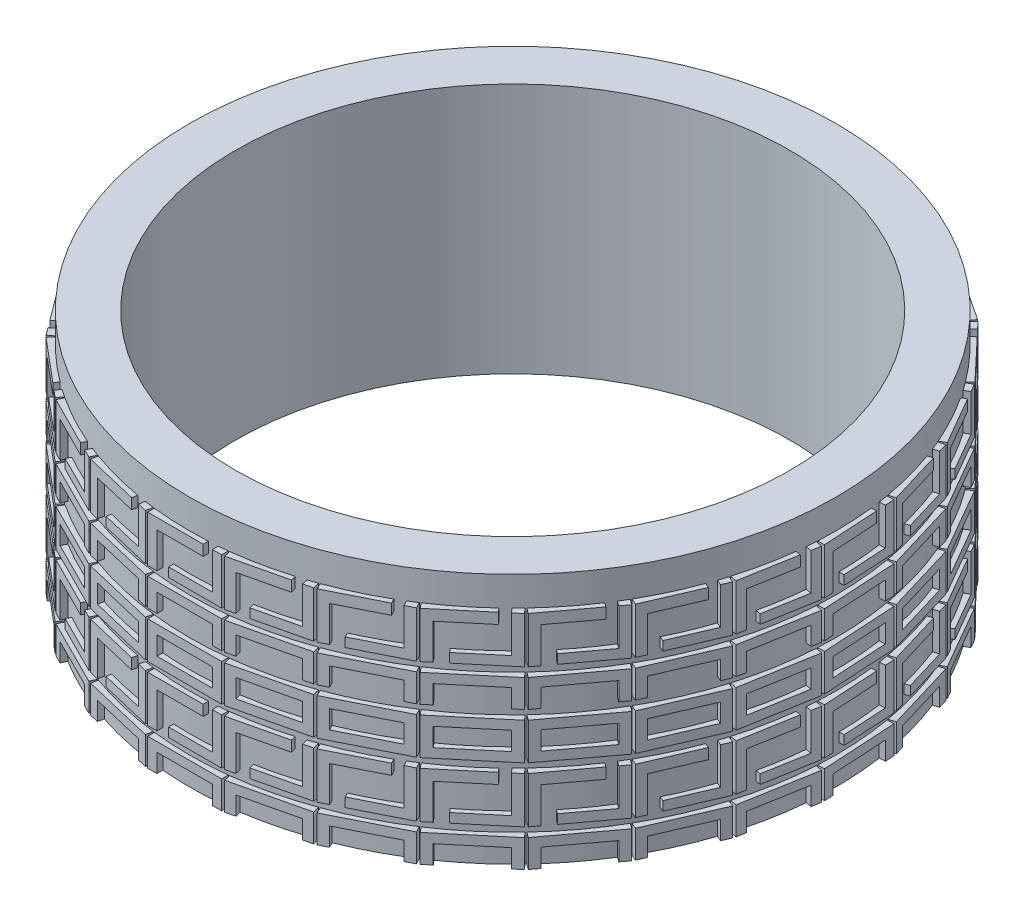
from build123d import *

# Parameters (mm, degrees)
CROQUIS1_R              = 35
CROQUIS1_R_2            = 30
SALIENTE_EXTRUIR1_DEPTH = 27.164179104
SALIENTE_EXTRUIR2_DEPTH = 0.5
MATRIZL1_COUNT          = 2
MATRIZL1_PITCH          = 15
CROQUIS3_W              = 8
CROQUIS3_H              = 4
CROQUIS3_W_2            = 6
CROQUIS3_H_2            = 2
SALIENTE_EXTRUIR3_DEPTH = 0.5
MATRIZC1_COUNT          = 27
MATRIZC1_COPY_1_DEPTH   = 0.5
MATRIZC1_COPY_2_DEPTH   = 0.5
MATRIZC1_COPY_3_DEPTH   = 0.5
MATRIZC1_COPY_4_DEPTH   = 0.5
MATRIZC1_COPY_5_DEPTH   = 0.5
MATRIZC1_COPY_6_DEPTH   = 0.5
MATRIZC1_COPY_7_DEPTH   = 0.5
MATRIZC1_COPY_8_DEPTH   = 0.5
MATRIZC1_COPY_9_DEPTH   = 0.5
MATRIZC1_COPY_10_DEPTH  = 0.5
MATRIZC1_COPY_11_DEPTH  = 0.5
MATRIZC1_COPY_12_DEPTH  = 0.5
MATRIZC1_COPY_13_DEPTH  = 0.5
MATRIZC1_COPY_14_DEPTH  = 0.5
MATRIZC1_COPY_15_DEPTH  = 0.5
MATRIZC1_COPY_16_DEPTH  = 0.5
MATRIZC1_COPY_17_DEPTH  = 0.5
MATRIZC1_COPY_18_DEPTH  = 0.5
MATRIZC1_COPY_19_DEPTH  = 0.5
MATRIZC1_COPY_20_DEPTH  = 0.5
MATRIZC1_COPY_21_DEPTH  = 0.5
MATRIZC1_COPY_22_DEPTH  = 0.5
MATRIZC1_COPY_23_DEPTH  = 0.5
MATRIZC1_COPY_24_DEPTH  = 0.5
MATRIZC1_COPY_25_DEPTH  = 0.5
MATRIZC1_COPY_26_DEPTH  = 0.5
SCALE1_SCALE            = 0.957142857


with BuildPart() as part:
    # Croquis1 → Saliente-Extruir1 (new body)
    with BuildSketch(Plane(origin=(0, 0, 0), x_dir=(1, 0, 0), z_dir=(0, 1, 0))):
        Circle(CROQUIS1_R)
        Circle(CROQUIS1_R_2, mode=Mode.SUBTRACT)
    extrude(amount=SALIENTE_EXTRUIR1_DEPTH)

    # Croquis2 → Saliente-Extruir2 (add, symmetric)
    with BuildSketch(Plane.XY.offset(35)):
        Polygon((-4, 0), (-4, 3), (4, 3), (4, 0), (3, 0), (3, 2), (-3, 2), (-3, 0), align=None)
        Polygon((0.140203198, 4), (4, 4), (4, 9), (3, 9), (3, 5), (-1.743288023, 5), (-1.743288023, 4), align=None)
        Polygon((-3, 4), (-3, 7.851159128), (2, 7.851159128), (2, 9), (-4, 9), (-4, 4), align=None)
    saliente_extruir2 = extrude(amount=SALIENTE_EXTRUIR2_DEPTH, both=True)

    # MatrizL1: Saliente-Extruir2 ×2
    with Locations(*[(0, i * MATRIZL1_PITCH, 0) for i in range(1, MATRIZL1_COUNT)]):
        add(saliente_extruir2)

    # Croquis3 → Saliente-Extruir3 (add, symmetric)
    with BuildSketch(Plane.XY.offset(35)):
        with Locations((0, 12)):
            Rectangle(CROQUIS3_W, CROQUIS3_H)
        with Locations((0, 12)):
            Rectangle(CROQUIS3_W_2, CROQUIS3_H_2, mode=Mode.SUBTRACT)
    saliente_extruir3 = extrude(amount=SALIENTE_EXTRUIR3_DEPTH, both=True)

    # MatrizC1: Saliente-Extruir2, Saliente-Extruir3 ×27 about axis
    matrizc1_axis = Axis((0, 0, 0), (0, 1, 0))
    add([saliente_extruir2.rotate(matrizc1_axis, i * 360 / MATRIZC1_COUNT) for i in range(1, MATRIZC1_COUNT)])
    add([saliente_extruir3.rotate(matrizc1_axis, i * 360 / MATRIZC1_COUNT) for i in range(1, MATRIZC1_COUNT)])

    # MatrizC1 copy 1 sketch → MatrizC1 copy 1 (add, symmetric)
    with BuildSketch(Plane(origin=(8.071555476, 15, 34.05657047), x_dir=(0.9730448705798238, 0, -0.23061587074244017), z_dir=(0.23061587074244017, 0, 0.9730448705798238))):
        Polygon((-4, 0), (-4, 3), (4, 3), (4, 0), (3, 0), (3, 2), (-3, 2), (-3, 0), align=None)
        Polygon((0.140203198, 4), (4, 4), (4, 9), (3, 9), (3, 5), (-1.743288023, 5), (-1.743288023, 4), align=None)
        Polygon((-3, 4), (-3, 7.851159128), (2, 7.851159128), (2, 9), (-4, 9), (-4, 4), align=None)
    extrude(amount=MATRIZC1_COPY_1_DEPTH, both=True)

    # MatrizC1 copy 2 sketch → MatrizC1 copy 2 (add, symmetric)
    with BuildSketch(Plane(origin=(15.707971307, 15, 31.277142411), x_dir=(0.8936326403234123, 0, -0.44879918020046217), z_dir=(0.44879918020046217, 0, 0.8936326403234123))):
        Polygon((-4, 0), (-4, 3), (4, 3), (4, 0), (3, 0), (3, 2), (-3, 2), (-3, 0), align=None)
        Polygon((0.140203198, 4), (4, 4), (4, 9), (3, 9), (3, 5), (-1.743288023, 5), (-1.743288023, 4), align=None)
        Polygon((-3, 4), (-3, 7.851159128), (2, 7.851159128), (2, 9), (-4, 9), (-4, 4), align=None)
    extrude(amount=MATRIZC1_COPY_2_DEPTH, both=True)

    # MatrizC1 copy 3 sketch → MatrizC1 copy 3 (add, symmetric)
    with BuildSketch(Plane(origin=(22.497566339, 15, 26.811555509), x_dir=(0.766044443118978, 0, -0.6427876096865393), z_dir=(0.6427876096865393, 0, 0.766044443118978))):
        Polygon((-4, 0), (-4, 3), (4, 3), (4, 0), (3, 0), (3, 2), (-3, 2), (-3, 0), align=None)
        Polygon((0.140203198, 4), (4, 4), (4, 9), (3, 9), (3, 5), (-1.743288023, 5), (-1.743288023, 4), align=None)
        Polygon((-3, 4), (-3, 7.851159128), (2, 7.851159128), (2, 9), (-4, 9), (-4, 4), align=None)
    extrude(amount=MATRIZC1_COPY_3_DEPTH, both=True)

    # MatrizC1 copy 4 sketch → MatrizC1 copy 4 (add, symmetric)
    with BuildSketch(Plane(origin=(28.074311746, 15, 20.90055071), x_dir=(0.5971585917027862, 0, -0.8021231927550437), z_dir=(0.8021231927550437, 0, 0.5971585917027862))):
        Polygon((-4, 0), (-4, 3), (4, 3), (4, 0), (3, 0), (3, 2), (-3, 2), (-3, 0), align=None)
        Polygon((0.140203198, 4), (4, 4), (4, 9), (3, 9), (3, 5), (-1.743288023, 5), (-1.743288023, 4), align=None)
        Polygon((-3, 4), (-3, 7.851159128), (2, 7.851159128), (2, 9), (-4, 9), (-4, 4), align=None)
    extrude(amount=MATRIZC1_COPY_4_DEPTH, both=True)

    # MatrizC1 copy 5 sketch → MatrizC1 copy 5 (add, symmetric)
    with BuildSketch(Plane(origin=(32.137563741, 15, 13.862791811), x_dir=(0.39607976603915673, 0, -0.9182161068802741), z_dir=(0.9182161068802741, 0, 0.39607976603915673))):
        Polygon((-4, 0), (-4, 3), (4, 3), (4, 0), (3, 0), (3, 2), (-3, 2), (-3, 0), align=None)
        Polygon((0.140203198, 4), (4, 4), (4, 9), (3, 9), (3, 5), (-1.743288023, 5), (-1.743288023, 4), align=None)
        Polygon((-3, 4), (-3, 7.851159128), (2, 7.851159128), (2, 9), (-4, 9), (-4, 4), align=None)
    extrude(amount=MATRIZC1_COPY_5_DEPTH, both=True)

    # MatrizC1 copy 6 sketch → MatrizC1 copy 6 (add, symmetric)
    with BuildSketch(Plane(origin=(34.468271355, 15, 6.077686218), x_dir=(0.17364817766693041, 0, -0.984807753012208), z_dir=(0.984807753012208, 0, 0.17364817766693041))):
        Polygon((-4, 0), (-4, 3), (4, 3), (4, 0), (3, 0), (3, 2), (-3, 2), (-3, 0), align=None)
        Polygon((0.140203198, 4), (4, 4), (4, 9), (3, 9), (3, 5), (-1.743288023, 5), (-1.743288023, 4), align=None)
        Polygon((-3, 4), (-3, 7.851159128), (2, 7.851159128), (2, 9), (-4, 9), (-4, 4), align=None)
    extrude(amount=MATRIZC1_COPY_6_DEPTH, both=True)

    # MatrizC1 copy 7 sketch → MatrizC1 copy 7 (add, symmetric)
    with BuildSketch(Plane(origin=(34.940785539, 15, -2.035069012), x_dir=(-0.058144828910475996, 0, -0.9983081582712682), z_dir=(0.9983081582712682, 0, -0.058144828910475996))):
        Polygon((-4, 0), (-4, 3), (4, 3), (4, 0), (3, 0), (3, 2), (-3, 2), (-3, 0), align=None)
        Polygon((0.140203198, 4), (4, 4), (4, 9), (3, 9), (3, 5), (-1.743288023, 5), (-1.743288023, 4), align=None)
        Polygon((-3, 4), (-3, 7.851159128), (2, 7.851159128), (2, 9), (-4, 9), (-4, 4), align=None)
    extrude(amount=MATRIZC1_COPY_7_DEPTH, both=True)

    # MatrizC1 copy 8 sketch → MatrizC1 copy 8 (add, symmetric)
    with BuildSketch(Plane(origin=(33.529632931, 15, -10.038113145), x_dir=(-0.2868032327110902, 0, -0.9579895123154889), z_dir=(0.9579895123154889, 0, -0.2868032327110902))):
        Polygon((-4, 0), (-4, 3), (4, 3), (4, 0), (3, 0), (3, 2), (-3, 2), (-3, 0), align=None)
        Polygon((0.140203198, 4), (4, 4), (4, 9), (3, 9), (3, 5), (-1.743288023, 5), (-1.743288023, 4), align=None)
        Polygon((-3, 4), (-3, 7.851159128), (2, 7.851159128), (2, 9), (-4, 9), (-4, 4), align=None)
    extrude(amount=MATRIZC1_COPY_8_DEPTH, both=True)

    # MatrizC1 copy 9 sketch → MatrizC1 copy 9 (add, symmetric)
    with BuildSketch(Plane(origin=(30.310889132, 15, -17.5), x_dir=(-0.4999999999999998, 0, -0.8660254037844387), z_dir=(0.8660254037844387, 0, -0.4999999999999998))):
        Polygon((-4, 0), (-4, 3), (4, 3), (4, 0), (3, 0), (3, 2), (-3, 2), (-3, 0), align=None)
        Polygon((0.140203198, 4), (4, 4), (4, 9), (3, 9), (3, 5), (-1.743288023, 5), (-1.743288023, 4), align=None)
        Polygon((-3, 4), (-3, 7.851159128), (2, 7.851159128), (2, 9), (-4, 9), (-4, 4), align=None)
    extrude(amount=MATRIZC1_COPY_9_DEPTH, both=True)

    # MatrizC1 copy 10 sketch → MatrizC1 copy 10 (add, symmetric)
    with BuildSketch(Plane(origin=(25.458077455, 15, -24.018457325), x_dir=(-0.6862416378687337, 0, -0.7273736415730485), z_dir=(0.7273736415730485, 0, -0.6862416378687337))):
        Polygon((-4, 0), (-4, 3), (4, 3), (4, 0), (3, 0), (3, 2), (-3, 2), (-3, 0), align=None)
        Polygon((0.140203198, 4), (4, 4), (4, 9), (3, 9), (3, 5), (-1.743288023, 5), (-1.743288023, 4), align=None)
        Polygon((-3, 4), (-3, 7.851159128), (2, 7.851159128), (2, 9), (-4, 9), (-4, 4), align=None)
    extrude(amount=MATRIZC1_COPY_10_DEPTH, both=True)

    # MatrizC1 copy 11 sketch → MatrizC1 copy 11 (add, symmetric)
    with BuildSketch(Plane(origin=(19.232814232, 15, -29.242073399), x_dir=(-0.8354878114129366, 0, -0.5495089780708058), z_dir=(0.5495089780708058, 0, -0.8354878114129366))):
        Polygon((-4, 0), (-4, 3), (4, 3), (4, 0), (3, 0), (3, 2), (-3, 2), (-3, 0), align=None)
        Polygon((0.140203198, 4), (4, 4), (4, 9), (3, 9), (3, 5), (-1.743288023, 5), (-1.743288023, 4), align=None)
        Polygon((-3, 4), (-3, 7.851159128), (2, 7.851159128), (2, 9), (-4, 9), (-4, 4), align=None)
    extrude(amount=MATRIZC1_COPY_11_DEPTH, both=True)

    # MatrizC1 copy 12 sketch → MatrizC1 copy 12 (add, symmetric)
    with BuildSketch(Plane(origin=(11.970705016, 15, -32.889241728), x_dir=(-0.9396926207859083, 0, -0.3420201433256689), z_dir=(0.3420201433256689, 0, -0.9396926207859083))):
        Polygon((-4, 0), (-4, 3), (4, 3), (4, 0), (3, 0), (3, 2), (-3, 2), (-3, 0), align=None)
        Polygon((0.140203198, 4), (4, 4), (4, 9), (3, 9), (3, 5), (-1.743288023, 5), (-1.743288023, 4), align=None)
        Polygon((-3, 4), (-3, 7.851159128), (2, 7.851159128), (2, 9), (-4, 9), (-4, 4), align=None)
    extrude(amount=MATRIZC1_COPY_12_DEPTH, both=True)

    # MatrizC1 copy 13 sketch → MatrizC1 copy 13 (add, symmetric)
    with BuildSketch(Plane(origin=(4.063251994, 15, -34.763342521), x_dir=(-0.993238357741943, 0, -0.11609291412522993), z_dir=(0.11609291412522993, 0, -0.993238357741943))):
        Polygon((-4, 0), (-4, 3), (4, 3), (4, 0), (3, 0), (3, 2), (-3, 2), (-3, 0), align=None)
        Polygon((0.140203198, 4), (4, 4), (4, 9), (3, 9), (3, 5), (-1.743288023, 5), (-1.743288023, 4), align=None)
        Polygon((-3, 4), (-3, 7.851159128), (2, 7.851159128), (2, 9), (-4, 9), (-4, 4), align=None)
    extrude(amount=MATRIZC1_COPY_13_DEPTH, both=True)

    # MatrizC1 copy 14 sketch → MatrizC1 copy 14 (add, symmetric)
    with BuildSketch(Plane(origin=(-4.063251994, 15, -34.763342521), x_dir=(-0.9932383577419429, 0, 0.11609291412523057), z_dir=(-0.11609291412523057, 0, -0.9932383577419429))):
        Polygon((-4, 0), (-4, 3), (4, 3), (4, 0), (3, 0), (3, 2), (-3, 2), (-3, 0), align=None)
        Polygon((0.140203198, 4), (4, 4), (4, 9), (3, 9), (3, 5), (-1.743288023, 5), (-1.743288023, 4), align=None)
        Polygon((-3, 4), (-3, 7.851159128), (2, 7.851159128), (2, 9), (-4, 9), (-4, 4), align=None)
    extrude(amount=MATRIZC1_COPY_14_DEPTH, both=True)

    # MatrizC1 copy 15 sketch → MatrizC1 copy 15 (add, symmetric)
    with BuildSketch(Plane(origin=(-11.970705016, 15, -32.889241728), x_dir=(-0.9396926207859084, 0, 0.34202014332566866), z_dir=(-0.34202014332566866, 0, -0.9396926207859084))):
        Polygon((-4, 0), (-4, 3), (4, 3), (4, 0), (3, 0), (3, 2), (-3, 2), (-3, 0), align=None)
        Polygon((0.140203198, 4), (4, 4), (4, 9), (3, 9), (3, 5), (-1.743288023, 5), (-1.743288023, 4), align=None)
        Polygon((-3, 4), (-3, 7.851159128), (2, 7.851159128), (2, 9), (-4, 9), (-4, 4), align=None)
    extrude(amount=MATRIZC1_COPY_15_DEPTH, both=True)

    # MatrizC1 copy 16 sketch → MatrizC1 copy 16 (add, symmetric)
    with BuildSketch(Plane(origin=(-19.232814232, 15, -29.242073399), x_dir=(-0.8354878114129365, 0, 0.549508978070806), z_dir=(-0.549508978070806, 0, -0.8354878114129365))):
        Polygon((-4, 0), (-4, 3), (4, 3), (4, 0), (3, 0), (3, 2), (-3, 2), (-3, 0), align=None)
        Polygon((0.140203198, 4), (4, 4), (4, 9), (3, 9), (3, 5), (-1.743288023, 5), (-1.743288023, 4), align=None)
        Polygon((-3, 4), (-3, 7.851159128), (2, 7.851159128), (2, 9), (-4, 9), (-4, 4), align=None)
    extrude(amount=MATRIZC1_COPY_16_DEPTH, both=True)

    # MatrizC1 copy 17 sketch → MatrizC1 copy 17 (add, symmetric)
    with BuildSketch(Plane(origin=(-25.458077455, 15, -24.018457325), x_dir=(-0.6862416378687333, 0, 0.727373641573049), z_dir=(-0.727373641573049, 0, -0.6862416378687333))):
        Polygon((-4, 0), (-4, 3), (4, 3), (4, 0), (3, 0), (3, 2), (-3, 2), (-3, 0), align=None)
        Polygon((0.140203198, 4), (4, 4), (4, 9), (3, 9), (3, 5), (-1.743288023, 5), (-1.743288023, 4), align=None)
        Polygon((-3, 4), (-3, 7.851159128), (2, 7.851159128), (2, 9), (-4, 9), (-4, 4), align=None)
    extrude(amount=MATRIZC1_COPY_17_DEPTH, both=True)

    # MatrizC1 copy 18 sketch → MatrizC1 copy 18 (add, symmetric)
    with BuildSketch(Plane(origin=(-30.310889132, 15, -17.5), x_dir=(-0.5000000000000004, 0, 0.8660254037844384), z_dir=(-0.8660254037844384, 0, -0.5000000000000004))):
        Polygon((-4, 0), (-4, 3), (4, 3), (4, 0), (3, 0), (3, 2), (-3, 2), (-3, 0), align=None)
        Polygon((0.140203198, 4), (4, 4), (4, 9), (3, 9), (3, 5), (-1.743288023, 5), (-1.743288023, 4), align=None)
        Polygon((-3, 4), (-3, 7.851159128), (2, 7.851159128), (2, 9), (-4, 9), (-4, 4), align=None)
    extrude(amount=MATRIZC1_COPY_18_DEPTH, both=True)

    # MatrizC1 copy 19 sketch → MatrizC1 copy 19 (add, symmetric)
    with BuildSketch(Plane(origin=(-33.529632931, 15, -10.038113145), x_dir=(-0.2868032327110898, 0, 0.957989512315489), z_dir=(-0.957989512315489, 0, -0.2868032327110898))):
        Polygon((-4, 0), (-4, 3), (4, 3), (4, 0), (3, 0), (3, 2), (-3, 2), (-3, 0), align=None)
        Polygon((0.140203198, 4), (4, 4), (4, 9), (3, 9), (3, 5), (-1.743288023, 5), (-1.743288023, 4), align=None)
        Polygon((-3, 4), (-3, 7.851159128), (2, 7.851159128), (2, 9), (-4, 9), (-4, 4), align=None)
    extrude(amount=MATRIZC1_COPY_19_DEPTH, both=True)

    # MatrizC1 copy 20 sketch → MatrizC1 copy 20 (add, symmetric)
    with BuildSketch(Plane(origin=(-34.940785539, 15, -2.035069012), x_dir=(-0.05814482891047535, 0, 0.9983081582712683), z_dir=(-0.9983081582712683, 0, -0.05814482891047535))):
        Polygon((-4, 0), (-4, 3), (4, 3), (4, 0), (3, 0), (3, 2), (-3, 2), (-3, 0), align=None)
        Polygon((0.140203198, 4), (4, 4), (4, 9), (3, 9), (3, 5), (-1.743288023, 5), (-1.743288023, 4), align=None)
        Polygon((-3, 4), (-3, 7.851159128), (2, 7.851159128), (2, 9), (-4, 9), (-4, 4), align=None)
    extrude(amount=MATRIZC1_COPY_20_DEPTH, both=True)

    # MatrizC1 copy 21 sketch → MatrizC1 copy 21 (add, symmetric)
    with BuildSketch(Plane(origin=(-34.468271355, 15, 6.077686218), x_dir=(0.17364817766692997, 0, 0.9848077530122081), z_dir=(-0.9848077530122081, 0, 0.17364817766692997))):
        Polygon((-4, 0), (-4, 3), (4, 3), (4, 0), (3, 0), (3, 2), (-3, 2), (-3, 0), align=None)
        Polygon((0.140203198, 4), (4, 4), (4, 9), (3, 9), (3, 5), (-1.743288023, 5), (-1.743288023, 4), align=None)
        Polygon((-3, 4), (-3, 7.851159128), (2, 7.851159128), (2, 9), (-4, 9), (-4, 4), align=None)
    extrude(amount=MATRIZC1_COPY_21_DEPTH, both=True)

    # MatrizC1 copy 22 sketch → MatrizC1 copy 22 (add, symmetric)
    with BuildSketch(Plane(origin=(-32.137563741, 15, 13.862791811), x_dir=(0.3960797660391573, 0, 0.9182161068802738), z_dir=(-0.9182161068802738, 0, 0.3960797660391573))):
        Polygon((-4, 0), (-4, 3), (4, 3), (4, 0), (3, 0), (3, 2), (-3, 2), (-3, 0), align=None)
        Polygon((0.140203198, 4), (4, 4), (4, 9), (3, 9), (3, 5), (-1.743288023, 5), (-1.743288023, 4), align=None)
        Polygon((-3, 4), (-3, 7.851159128), (2, 7.851159128), (2, 9), (-4, 9), (-4, 4), align=None)
    extrude(amount=MATRIZC1_COPY_22_DEPTH, both=True)

    # MatrizC1 copy 23 sketch → MatrizC1 copy 23 (add, symmetric)
    with BuildSketch(Plane(origin=(-28.074311746, 15, 20.90055071), x_dir=(0.5971585917027866, 0, 0.8021231927550435), z_dir=(-0.8021231927550435, 0, 0.5971585917027866))):
        Polygon((-4, 0), (-4, 3), (4, 3), (4, 0), (3, 0), (3, 2), (-3, 2), (-3, 0), align=None)
        Polygon((0.140203198, 4), (4, 4), (4, 9), (3, 9), (3, 5), (-1.743288023, 5), (-1.743288023, 4), align=None)
        Polygon((-3, 4), (-3, 7.851159128), (2, 7.851159128), (2, 9), (-4, 9), (-4, 4), align=None)
    extrude(amount=MATRIZC1_COPY_23_DEPTH, both=True)

    # MatrizC1 copy 24 sketch → MatrizC1 copy 24 (add, symmetric)
    with BuildSketch(Plane(origin=(-22.497566339, 15, 26.811555509), x_dir=(0.7660444431189778, 0, 0.6427876096865396), z_dir=(-0.6427876096865396, 0, 0.7660444431189778))):
        Polygon((-4, 0), (-4, 3), (4, 3), (4, 0), (3, 0), (3, 2), (-3, 2), (-3, 0), align=None)
        Polygon((0.140203198, 4), (4, 4), (4, 9), (3, 9), (3, 5), (-1.743288023, 5), (-1.743288023, 4), align=None)
        Polygon((-3, 4), (-3, 7.851159128), (2, 7.851159128), (2, 9), (-4, 9), (-4, 4), align=None)
    extrude(amount=MATRIZC1_COPY_24_DEPTH, both=True)

    # MatrizC1 copy 25 sketch → MatrizC1 copy 25 (add, symmetric)
    with BuildSketch(Plane(origin=(-15.707971307, 15, 31.277142411), x_dir=(0.8936326403234125, 0, 0.44879918020046167), z_dir=(-0.44879918020046167, 0, 0.8936326403234125))):
        Polygon((-4, 0), (-4, 3), (4, 3), (4, 0), (3, 0), (3, 2), (-3, 2), (-3, 0), align=None)
        Polygon((0.140203198, 4), (4, 4), (4, 9), (3, 9), (3, 5), (-1.743288023, 5), (-1.743288023, 4), align=None)
        Polygon((-3, 4), (-3, 7.851159128), (2, 7.851159128), (2, 9), (-4, 9), (-4, 4), align=None)
    extrude(amount=MATRIZC1_COPY_25_DEPTH, both=True)

    # MatrizC1 copy 26 sketch → MatrizC1 copy 26 (add, symmetric)
    with BuildSketch(Plane(origin=(-8.071555476, 15, 34.05657047), x_dir=(0.973044870579824, 0, 0.23061587074243958), z_dir=(-0.23061587074243958, 0, 0.973044870579824))):
        Polygon((-4, 0), (-4, 3), (4, 3), (4, 0), (3, 0), (3, 2), (-3, 2), (-3, 0), align=None)
        Polygon((0.140203198, 4), (4, 4), (4, 9), (3, 9), (3, 5), (-1.743288023, 5), (-1.743288023, 4), align=None)
        Polygon((-3, 4), (-3, 7.851159128), (2, 7.851159128), (2, 9), (-4, 9), (-4, 4), align=None)
    extrude(amount=MATRIZC1_COPY_26_DEPTH, both=True)


with BuildPart() as part_1:
    # Scale1: scaled about (0, 13.519604962, 0)
    add(part.part.scale(SCALE1_SCALE).moved(Location((0, 0.579411641, 0))))


solid = part_1.part
